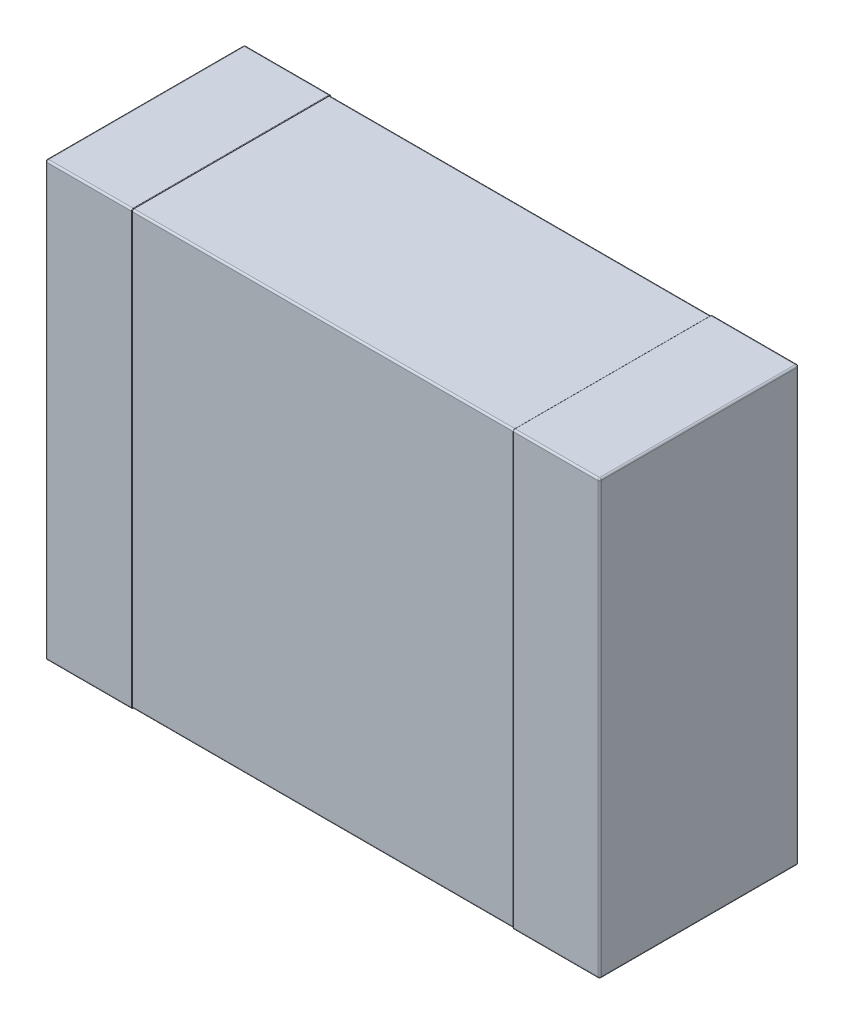
from build123d import *

# Parameters (mm, degrees)
SKETCH1_W                           = 3.2
SKETCH1_H                           = 2.5
ALL_BODY_DEPTH                      = 1.15
CUT_OUT_THE_BODY_FOR_PIN_DEPTH      = 1.1
CUT_OUT_THE_BODY_FOR_PIN_DEPTH_BACK = 1.1
SKETCH2_OUTSIDE_W                   = 3.994
SKETCH2_OUTSIDE_H                   = 5.344
SKETCH2_OUTSIDE_W_2                 = 1.144
SKETCH2_OUTSIDE_H_2                 = 2.494
BODY_FILLET_R                       = 0.01
PIN_FILLET_A_R                      = 0.01
PIN_FILLET_B_R                      = 0.003


with BuildPart() as part:
    # Sketch1 → All body (new body)
    with BuildSketch(Plane.XY):
        Rectangle(SKETCH1_W, SKETCH1_H)
    extrude(amount=ALL_BODY_DEPTH)

    # Sketch2 outside → Cut out the body for pin (cut, two sides: drawn at the far end of the back side and taken through both)
    with BuildSketch(Plane(origin=(0, 0, 0), x_dir=(0, 0, -1), z_dir=(1, 0, 0)).offset(-CUT_OUT_THE_BODY_FOR_PIN_DEPTH_BACK)):
        with Locations((-0.575, 0)):
            Rectangle(SKETCH2_OUTSIDE_W, SKETCH2_OUTSIDE_H)
        with Locations((-0.575, 0)):
            Rectangle(SKETCH2_OUTSIDE_W_2, SKETCH2_OUTSIDE_H_2, mode=Mode.SUBTRACT)
    extrude(amount=CUT_OUT_THE_BODY_FOR_PIN_DEPTH + CUT_OUT_THE_BODY_FOR_PIN_DEPTH_BACK, mode=Mode.SUBTRACT)

    # Body fillet
    body_fillet_edges = [part.edges().sort_by_distance(p)[0] for p in [
        (0, 1.247, 0.003),
        (0, 1.247, 1.147),
        (0, -1.247, 1.147),
        (0, -1.247, 0.003),
    ]]
    fillet(body_fillet_edges, radius=BODY_FILLET_R)

    # Pin fillet a
    pin_fillet_a_edges = [part.edges().sort_by_distance(p)[0] for p in [
        (1.6, 0, 1.15),
        (-1.35, 1.25, 0),
        (1.35, -1.25, 0),
        (1.35, -1.25, 1.15),
        (-1.35, 1.25, 1.15),
        (1.35, 1.25, 1.15),
        (-1.6, 0, 1.15),
        (1.35, 1.25, 0),
        (1.6, 0, 0),
        (-1.35, -1.25, 0),
        (-1.6, 0, 0),
        (-1.6, 1.25, 0.575),
        (1.6, 1.25, 0.575),
        (1.6, -1.25, 0.575),
        (-1.6, -1.25, 0.575),
        (-1.35, -1.25, 1.15),
    ]]
    fillet(pin_fillet_a_edges, radius=PIN_FILLET_A_R)

    # Pin fillet b
    pin_fillet_b_edges = [part.edges().sort_by_distance(p)[0] for p in [
        (1.1, -1.25, 0.575),
        (1.1, 0, 1.15),
        (1.1, 1.25, 0.575),
        (1.1, 0, 0),
        (-1.1, 1.25, 0.575),
        (-1.1, 0, 1.15),
        (-1.1, -1.25, 0.575),
        (-1.1, 0, 0),
        (1.1, 1.247071068, 0.002928932),
        (1.1, -1.247071068, 0.002928932),
        (1.1, -1.247071068, 1.147071068),
        (1.1, 1.247071068, 1.147071068),
        (-1.1, -1.247071068, 1.147071068),
        (-1.1, 1.247071068, 1.147071068),
        (-1.1, -1.247071068, 0.002928932),
        (-1.1, 1.247071068, 0.002928932),
    ]]
    fillet(pin_fillet_b_edges, radius=PIN_FILLET_B_R - 0.0001)  # a hair under: the kernel refuses the full size


solid = part.part
